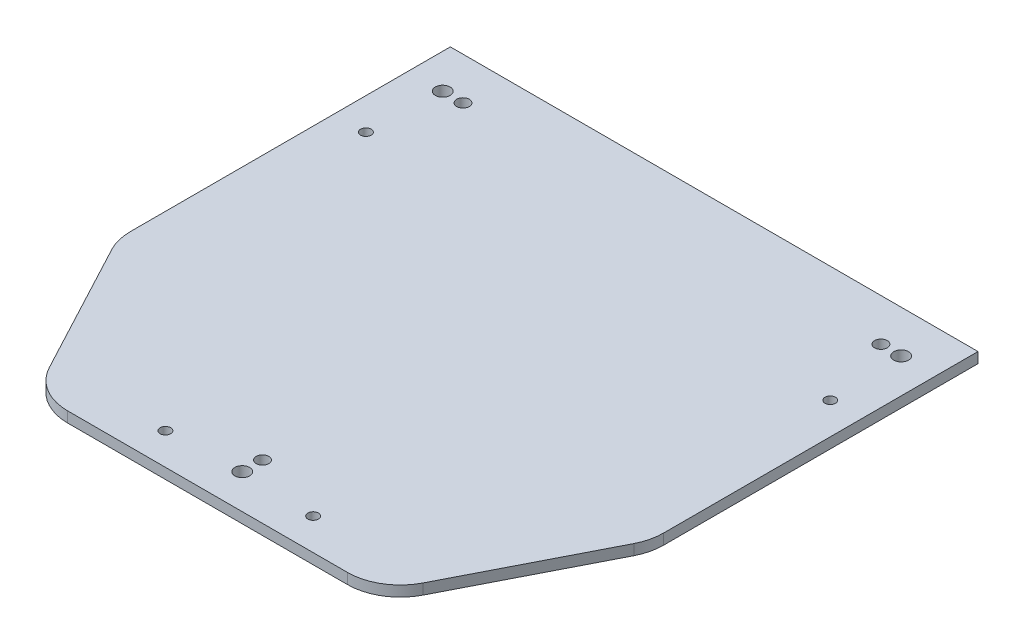
from build123d import *

# Parameters (mm, degrees)
RESSALTO_EXTRUS_O4_DEPTH = 5
ESBO_O2_R                = 2.5
ESBO_O2_R_2              = 3.5
ESBO_O2_R_3              = 3
CORTE_EXTRUS_O1_DEPTH    = 5


with BuildPart() as part:
    # Esboço1 → Ressalto-extrusão4 (new body)
    with BuildSketch(Plane(origin=(0, 0, 0), x_dir=(1, 0, 0), z_dir=(0, 1, 0))):
        with BuildLine():
            Line((470.007423898, -115.796995794), (602.527286899, -115.796995794))
            ThreePointArc((602.527286899, -115.796995794), (615.578185817, -112.120082753), (624.7901231, -102.17091879))
            Line((624.7901231, -102.17091879), (658.530191599, -36.129534592))
            ThreePointArc((658.530191599, -36.129534592), (660.573433908, -30.604931856), (661.267355398, -24.755611597))
            Line((661.267355398, -24.755611597), (661.267355398, 84.203004206))
            Line((661.267355398, 84.203004206), (661.267355398, 124.203004206))
            Line((661.267355398, 124.203004206), (411.267355398, 124.203004206))
            Line((411.267355398, 124.203004206), (411.267355398, 81.588187759))
            Line((411.267355398, 81.588187759), (411.267355398, -27.370428044))
            ThreePointArc((411.267355398, -27.370428044), (412.010540804, -33.420795447), (414.195911055, -39.11143927))
            Line((414.195911055, -39.11143927), (447.935979555, -102.53800702))
            ThreePointArc((447.935979555, -102.53800702), (457.133521627, -112.227409704), (470.007423898, -115.796995794))
        make_face()
    extrude(amount=RESSALTO_EXTRUS_O4_DEPTH)

    # Esboço2 → Corte-extrusão1 (cut)
    with BuildSketch(Plane(origin=(0, 5, 0), x_dir=(1, 0, 0), z_dir=(0, 1, 0))):
        with Locations((571.267355398, -100.796995794)):
            Circle(ESBO_O2_R)
        with Locations((501.267355398, -100.796995794)):
            Circle(ESBO_O2_R)
        with Locations((646.267355398, 69.203004206)):
            Circle(ESBO_O2_R)
        with Locations((426.267355398, 69.203004206)):
            Circle(ESBO_O2_R)
        with Locations((536.267355398, -99.396995794)):
            Circle(ESBO_O2_R_2)
        with Locations((536.267355398, -89.796995794)):
            Circle(ESBO_O2_R_3)
        with Locations((644.867355398, 104.203004206)):
            Circle(ESBO_O2_R_2)
        with Locations((635.267355398, 104.203004206)):
            Circle(ESBO_O2_R_3)
        with Locations((427.667355398, 104.203004206)):
            Circle(ESBO_O2_R_2)
        with Locations((437.267355398, 104.203004206)):
            Circle(ESBO_O2_R_3)
    extrude(amount=-CORTE_EXTRUS_O1_DEPTH, mode=Mode.SUBTRACT)


solid = part.part
